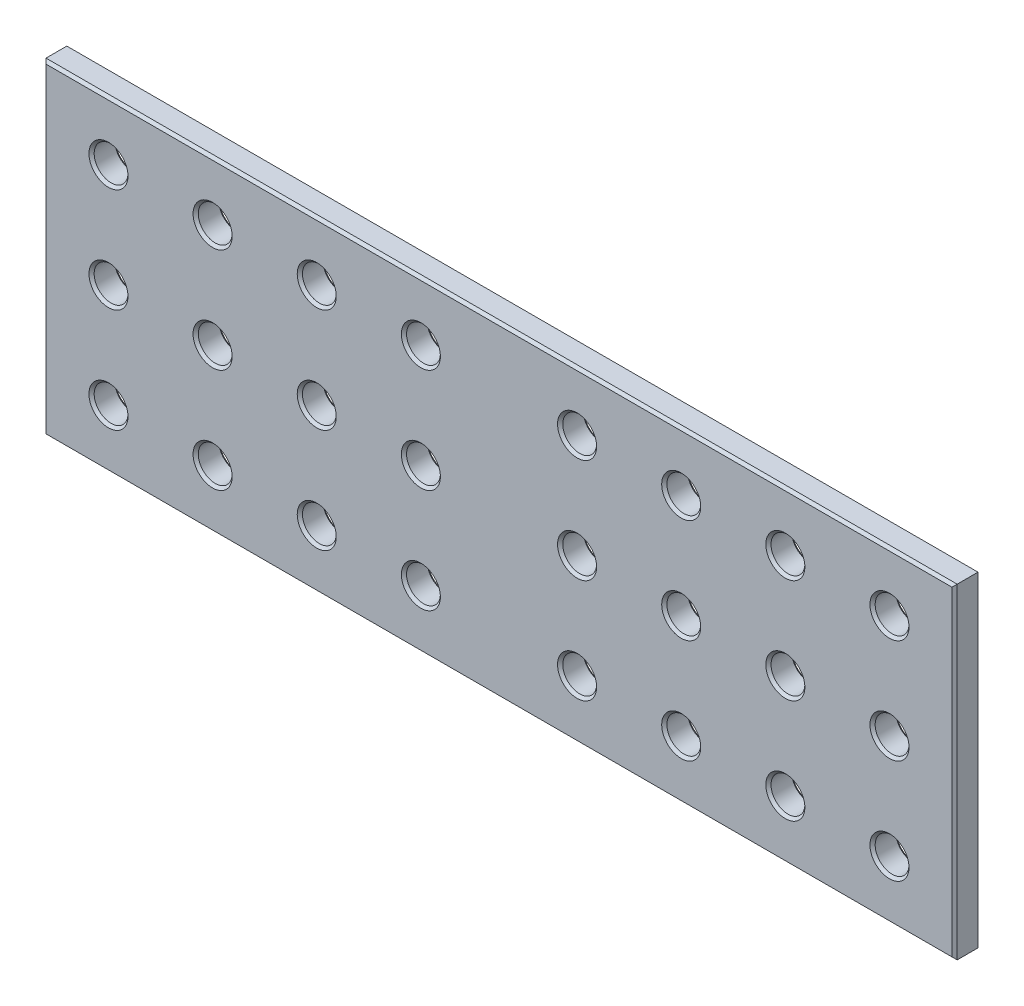
from build123d import *

# Parameters (mm, degrees)
SKETCH_1_W        = 700
SKETCH_1_H        = 250
SKETCH_1_R        = 13
EXTRUDE_624_DEPTH = 20
CHAMFER_1_SIZE    = 2


with BuildPart() as part:
    # 草图1 → Extrude 624 (new body)
    with BuildSketch(Plane.XY):
        Rectangle(SKETCH_1_W, SKETCH_1_H)
        with Locations((-300, 80)):
            Circle(SKETCH_1_R, mode=Mode.SUBTRACT)
        with Locations((-220, 80)):
            Circle(SKETCH_1_R, mode=Mode.SUBTRACT)
        with Locations((-140, 80)):
            Circle(SKETCH_1_R, mode=Mode.SUBTRACT)
        with Locations((-60, 80)):
            Circle(SKETCH_1_R, mode=Mode.SUBTRACT)
        with Locations((-60, 0)):
            Circle(SKETCH_1_R, mode=Mode.SUBTRACT)
        with Locations((-220, 0)):
            Circle(SKETCH_1_R, mode=Mode.SUBTRACT)
        with Locations((-300, 0)):
            Circle(SKETCH_1_R, mode=Mode.SUBTRACT)
        with Locations((-140, 0)):
            Circle(SKETCH_1_R, mode=Mode.SUBTRACT)
        with Locations((-60, -80)):
            Circle(SKETCH_1_R, mode=Mode.SUBTRACT)
        with Locations((-140, -80)):
            Circle(SKETCH_1_R, mode=Mode.SUBTRACT)
        with Locations((-220, -80)):
            Circle(SKETCH_1_R, mode=Mode.SUBTRACT)
        with Locations((-300, -80)):
            Circle(SKETCH_1_R, mode=Mode.SUBTRACT)
        with Locations((300, -80)):
            Circle(SKETCH_1_R, mode=Mode.SUBTRACT)
        with Locations((220, -80)):
            Circle(SKETCH_1_R, mode=Mode.SUBTRACT)
        with Locations((140, -80)):
            Circle(SKETCH_1_R, mode=Mode.SUBTRACT)
        with Locations((60, -80)):
            Circle(SKETCH_1_R, mode=Mode.SUBTRACT)
        with Locations((140, 0)):
            Circle(SKETCH_1_R, mode=Mode.SUBTRACT)
        with Locations((300, 0)):
            Circle(SKETCH_1_R, mode=Mode.SUBTRACT)
        with Locations((220, 0)):
            Circle(SKETCH_1_R, mode=Mode.SUBTRACT)
        with Locations((60, 0)):
            Circle(SKETCH_1_R, mode=Mode.SUBTRACT)
        with Locations((60, 80)):
            Circle(SKETCH_1_R, mode=Mode.SUBTRACT)
        with Locations((140, 80)):
            Circle(SKETCH_1_R, mode=Mode.SUBTRACT)
        with Locations((220, 80)):
            Circle(SKETCH_1_R, mode=Mode.SUBTRACT)
        with Locations((300, 80)):
            Circle(SKETCH_1_R, mode=Mode.SUBTRACT)
    extrude(amount=EXTRUDE_624_DEPTH)

    # 倒角1
    chamfer_1_edges = [part.edges().sort_by_distance(p)[0] for p in [
        (287, 80, 0),
        (127, 80, 0),
        (47, 0, 0),
        (287, 0, 0),
        (47, -80, 0),
        (207, -80, 0),
        (-313, -80, 0),
        (-153, -80, 0),
        (-153, 0, 0),
        (-233, 0, 0),
        (-73, 80, 0),
        (-233, 80, 0),
        (0, -125, 0),
        (350, 0, 0),
        (0, 125, 0),
        (-350, 0, 0),
        (-313, 80, 0),
        (-153, 80, 0),
        (-73, 0, 0),
        (-313, 0, 0),
        (-73, -80, 0),
        (-233, -80, 0),
        (287, -80, 0),
        (127, -80, 0),
        (127, 0, 0),
        (207, 0, 0),
        (47, 80, 0),
        (207, 80, 0),
        (287, 80, 20),
        (127, 80, 20),
        (47, 0, 20),
        (287, 0, 20),
        (47, -80, 20),
        (207, -80, 20),
        (-313, -80, 20),
        (-153, -80, 20),
        (-153, 0, 20),
        (-233, 0, 20),
        (-73, 80, 20),
        (-233, 80, 20),
        (0, 125, 20),
        (350, 0, 20),
        (0, -125, 20),
        (-350, 0, 20),
        (-313, 80, 20),
        (-153, 80, 20),
        (-73, 0, 20),
        (-313, 0, 20),
        (-73, -80, 20),
        (-233, -80, 20),
        (287, -80, 20),
        (127, -80, 20),
        (127, 0, 20),
        (207, 0, 20),
        (47, 80, 20),
        (207, 80, 20),
    ]]
    chamfer(chamfer_1_edges, length=CHAMFER_1_SIZE)


solid = part.part
